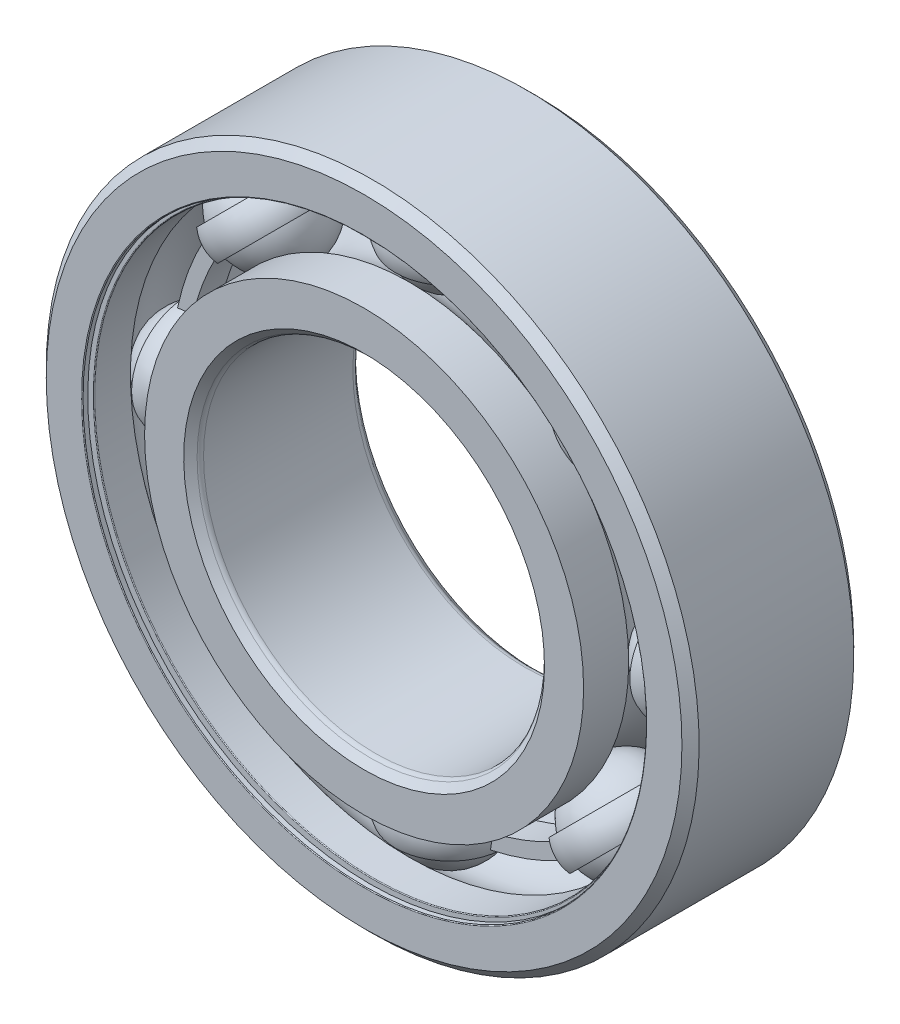
from build123d import *

# Parameters (mm, degrees)
BOSS_EXTRUDE1_DEPTH = 0.416666667
CIRPATTERN1_COUNT   = 8
CIRPATTERN2_COUNT   = 8
FILLET1_R           = 0.0225
FILLET2_R           = 0.1875


with BuildPart() as part:
    # Sketch3 → Revolve1 (revolve)
    with BuildSketch(Plane(origin=(0, 0, 0), x_dir=(0, 0, -1), z_dir=(1, 0, 0))):
        with BuildLine():
            Line((2.25, 9.5), (2.5, 9.25))
            Line((2.5, 9.25), (2.5, 8.111538462))
            Line((2.5, 8.111538462), (1.1875, 8.111538462))
            ThreePointArc((1.1875, 8.111538462), (0, 8.717107621), (-1.1875, 8.111538462))
            Line((-1.1875, 8.111538462), (-2.5, 8.111538462))
            Line((-2.5, 8.111538462), (-2.5, 9.25))
            Line((-2.5, 9.25), (-2.25, 9.5))
            Line((-2.25, 9.5), (2.25, 9.5))
        make_face()
    revolve(axis=Axis((0, 0, 2.5), (0, 0, -1)))

    # Sketch8 → Cut-Revolve1 (revolve, cut)
    with BuildSketch(Plane(origin=(0, 0, 0), x_dir=(0, 0, -1), z_dir=(1, 0, 0))):
        Polygon((-2.34, 8.111538462), (-2.25, 8.111538462), (-2.25, 8.574358974), (-2.34, 8.574358974), (-2.34, 8.201538462), (-2.5, 8.201538462), (-2.5, 8.111538462), align=None)
        Polygon((2.25, 8.111538462), (2.34, 8.111538462), (2.5, 8.111538462), (2.5, 8.201538462), (2.34, 8.201538462), (2.34, 8.574358974), (2.25, 8.574358974), align=None)
    revolve(axis=Axis((0, 0, 2.5), (0, 0, -1)), mode=Mode.SUBTRACT)

    # Fillet1
    fillet1_edges = [part.edges().sort_by_distance(p)[0] for p in [
        (0, -8.111538462, -2.25),
        (0, -8.201538462, -2.5),
        (0, -8.111538462, 2.25),
        (0, -8.201538462, 2.5),
    ]]
    fillet(fillet1_edges, radius=FILLET1_R)


with BuildPart() as body_2:
    # Sketch4 → Revolve2 (revolve)
    with BuildSketch(Plane(origin=(0, 0, 0), x_dir=(0, 0, -1), z_dir=(1, 0, 0))):
        with BuildLine():
            Line((-2.25, 5), (-2.5, 5.25))
            Line((-2.5, 5.25), (-2.5, 6.388461538))
            Line((-2.5, 6.388461538), (-1.1875, 6.388461538))
            ThreePointArc((-1.1875, 6.388461538), (0, 5.782892379), (1.1875, 6.388461538))
            Line((1.1875, 6.388461538), (2.5, 6.388461538))
            Line((2.5, 6.388461538), (2.5, 5.25))
            Line((2.5, 5.25), (2.25, 5))
            Line((2.25, 5), (-2.25, 5))
        make_face()
    revolve(axis=Axis((0, 0, 2.5), (0, 0, -1)))

    # Fillet2
    fillet2_edges = [body_2.edges().sort_by_distance(p)[0] for p in [
        (0, -5, -2.25),
        (0, -5, 2.25),
    ]]
    fillet(fillet2_edges, radius=FILLET2_R)


with BuildPart() as body_3:
    # Sketch5 → Revolve3 (revolve)
    with BuildSketch(Plane(origin=(0, 0, 0), x_dir=(0, 0, -1), z_dir=(1, 0, 0))):
        with BuildLine():
            Line((-1.467107621, 7.25), (1.467107621, 7.25))
            ThreePointArc((1.467107621, 7.25), (0, 8.717107621), (-1.467107621, 7.25))
        make_face()
    revolve(axis=Axis((0, 7.25, 1.467107621), (0, 0, -1)))


with BuildPart() as body_4:
    # Sketch6 → Revolve4 (revolve)
    with BuildSketch(Plane(origin=(0, 0, 0), x_dir=(0, 0, -1), z_dir=(1, 0, 0))):
        with BuildLine():
            Line((-1.402441671, 7.680769231), (-1.585368059, 7.680769231))
            ThreePointArc((-1.585368059, 7.680769231), (-1.676831253, 7.25), (-1.585368059, 6.819230769))
            Line((-1.585368059, 6.819230769), (-1.402441671, 6.819230769))
            ThreePointArc((-1.402441671, 6.819230769), (-1.467107621, 7.25), (-1.402441671, 7.680769231))
        make_face()
    revolve4 = revolve(axis=Axis((0, 9.5, 0), (0, -1, 0)))

    # Sketch7 → Boss-Extrude1 (add, symmetric)
    with BuildSketch(Plane.XY):
        with BuildLine():
            Line((5.126524164, 5.126524164), (5.431124008, 5.431124008))
            ThreePointArc((5.431124008, 5.431124008), (2.939303132, 7.096105486), (0, 7.680769231))
            Line((0, 7.680769231), (0, 7.25))
            ThreePointArc((0, 7.25), (2.774454885, 6.698126611), (5.126524164, 5.126524164))
        make_face()
    boss_extrude1 = extrude(amount=BOSS_EXTRUDE1_DEPTH, both=True)

    # CirPattern2: Revolve4, Boss-Extrude1 ×8 about axis
    cirpattern2_axis = Axis((0, 0, 2.5), (0, 0, -1))
    add([revolve4.rotate(cirpattern2_axis, i * 360 / CIRPATTERN2_COUNT) for i in range(1, CIRPATTERN2_COUNT)])
    add([boss_extrude1.rotate(cirpattern2_axis, i * 360 / CIRPATTERN2_COUNT) for i in range(1, CIRPATTERN2_COUNT)])


with BuildPart() as cirpattern1_1:
    # CirPattern1: pattern copy
    add(body_3.part.rotate(Axis((0, 0, 2.5), (0, 0, -1)), 1 * 360 / CIRPATTERN1_COUNT))


with BuildPart() as cirpattern1_2:
    # CirPattern1: pattern copy
    add(body_3.part.rotate(Axis((0, 0, 2.5), (0, 0, -1)), 2 * 360 / CIRPATTERN1_COUNT))


with BuildPart() as cirpattern1_3:
    # CirPattern1: pattern copy
    add(body_3.part.rotate(Axis((0, 0, 2.5), (0, 0, -1)), 3 * 360 / CIRPATTERN1_COUNT))


with BuildPart() as cirpattern1_4:
    # CirPattern1: pattern copy
    add(body_3.part.rotate(Axis((0, 0, 2.5), (0, 0, -1)), 4 * 360 / CIRPATTERN1_COUNT))


with BuildPart() as cirpattern1_5:
    # CirPattern1: pattern copy
    add(body_3.part.rotate(Axis((0, 0, 2.5), (0, 0, -1)), 5 * 360 / CIRPATTERN1_COUNT))


with BuildPart() as cirpattern1_6:
    # CirPattern1: pattern copy
    add(body_3.part.rotate(Axis((0, 0, 2.5), (0, 0, -1)), 6 * 360 / CIRPATTERN1_COUNT))


with BuildPart() as cirpattern1_7:
    # CirPattern1: pattern copy
    add(body_3.part.rotate(Axis((0, 0, 2.5), (0, 0, -1)), 7 * 360 / CIRPATTERN1_COUNT))


solid = Compound([part.part, body_2.part, body_3.part, body_4.part, cirpattern1_1.part, cirpattern1_2.part, cirpattern1_3.part, cirpattern1_4.part, cirpattern1_5.part, cirpattern1_6.part, cirpattern1_7.part])
